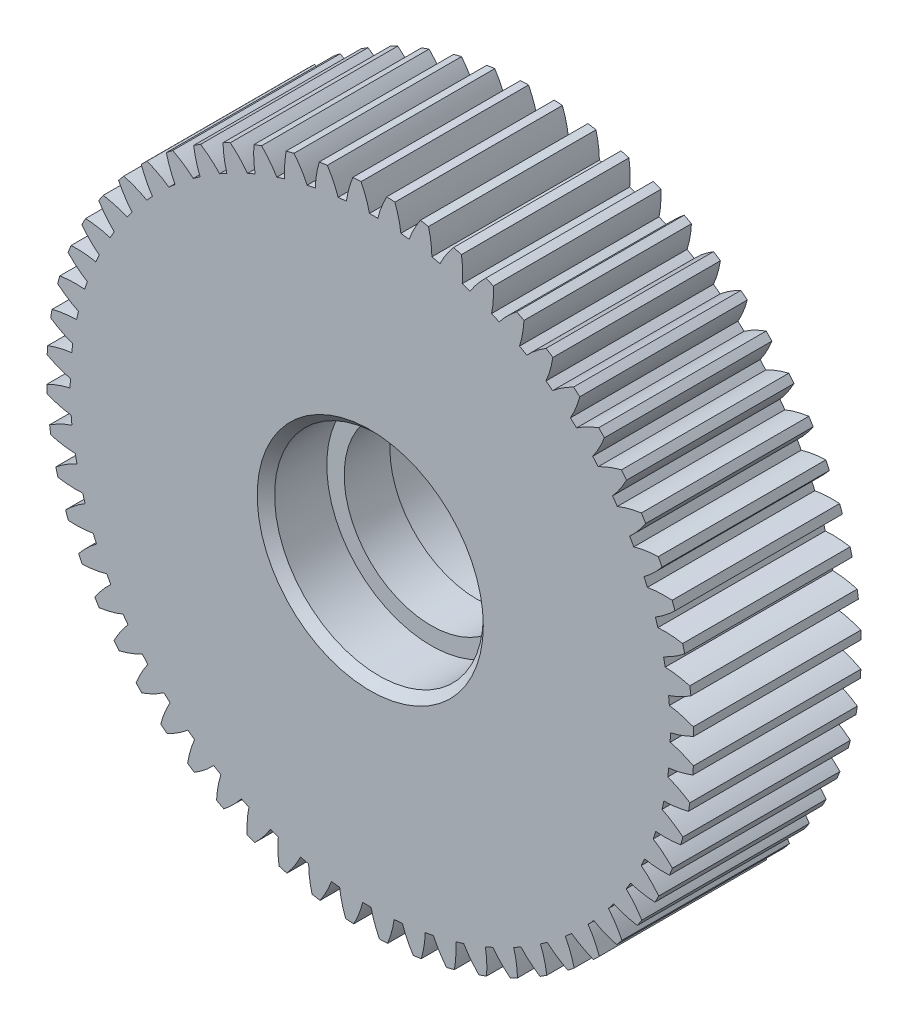
from build123d import *

# Parameters (mm, degrees)
SKETCH1_R               = 18.6
BOSS_EXTRUDE1_DEPTH     = 4.81475149
CUT_EXTRUDE1_DEPTH      = 27.741387995
CIRPATTERN2_COUNT       = 60
CUT_EXTRUDE2_DEPTH      = 29.001587569
CUT_EXTRUDE2_DEPTH_BACK = 29.001587569
SKETCH3_R               = 5
SKETCH4_R               = 6
CUT_EXTRUDE3_DEPTH      = 3.5
CHAMFER1_SIZE           = 0.5


with BuildPart() as part:
    # Sketch1 → Boss-Extrude1 (new, symmetric)
    with BuildSketch(Plane.XY):
        Circle(SKETCH1_R)
    extrude(amount=BOSS_EXTRUDE1_DEPTH, both=True)

    # Sketch2 → Cut-Extrude1 (cut, symmetric)
    with BuildSketch(Plane.XY):
        with BuildLine():
            ThreePointArc((17.249941202, 0.045039321), (17.2499853, 0.022519679), (17.25, 0))
            ThreePointArc((17.25, 0), (17.248903445, -0.194499201), (17.24561392, -0.388973675))
            ThreePointArc((17.24561392, -0.388973675), (17.245091423, -0.411487297), (17.244539536, -0.434000217))
            add(Edge.make_bspline(
                [(17.244539536, -0.434000217), (17.258527817, -0.437168535), (17.301163555, -0.44707828), (17.37218596, -0.464820787), (17.471136217, -0.492172992), (17.583720317, -0.526522356), (17.695488424, -0.563644772), (17.806310075, -0.603194988), (17.939890448, -0.654126402), (18.099116702, -0.719393509), (18.278642536, -0.799487731), (18.428403846, -0.87186963), (18.528503739, -0.922855573), (18.575850084, -0.947519737)],
                knots=[0.078773782, 0.078773782, 0.078773782, 0.078773782, 0.078773782, 0.092110525, 0.119476176, 0.146842496, 0.174208854, 0.201574956, 0.228941013, 0.256307345, 0.307035032, 0.361767352, 0.411345658, 0.411345658, 0.411345658, 0.411345658, 0.411345658], degree=4))
            ThreePointArc((18.575850084, -0.947519737), (18.593961541, -0.473913724), (18.6, 0))
            ThreePointArc((18.6, 0), (18.59812308, 0.264230806), (18.592492697, 0.528408284))
            add(Edge.make_bspline(
                [(17.249941202, 0.045039321), (17.263997369, 0.047891408), (17.306845723, 0.056837232), (17.378250149, 0.072973729), (17.477792016, 0.09808773), (17.59112204, 0.129889679), (17.703698809, 0.164482375), (17.815384108, 0.201523596), (17.950078978, 0.249429929), (18.110736468, 0.311090016), (18.292022715, 0.38711571), (18.4433781, 0.456102207), (18.544602233, 0.504818013), (18.592492697, 0.528408284)],
                knots=[0.078773782, 0.078773782, 0.078773782, 0.078773782, 0.078773782, 0.092110525, 0.119476176, 0.146842496, 0.174208854, 0.201574956, 0.228941013, 0.256307345, 0.307035032, 0.361767352, 0.411345658, 0.411345658, 0.411345658, 0.411345658, 0.411345658], degree=4))
        make_face()
    cut_extrude1 = extrude(amount=CUT_EXTRUDE1_DEPTH, both=True, mode=Mode.SUBTRACT)

    # CirPattern2: Cut-Extrude1 ×60 about axis
    cirpattern2_axis = Axis((0, 0, -4.81475149), (0, 0, 1))
    for i in range(1, CIRPATTERN2_COUNT):
        add(cut_extrude1.rotate(cirpattern2_axis, i * 360 / CIRPATTERN2_COUNT), mode=Mode.SUBTRACT)

    # Sketch3 → Cut-Extrude2 (cut, two sides: drawn at the far end of the back side and taken through both)
    with BuildSketch(Plane.XY.offset(4.81475149).offset(-CUT_EXTRUDE2_DEPTH_BACK)):
        Circle(SKETCH3_R)
    extrude(amount=CUT_EXTRUDE2_DEPTH + CUT_EXTRUDE2_DEPTH_BACK, mode=Mode.SUBTRACT)

    # Sketch4 → Cut-Extrude3 (cut)
    with BuildSketch(Plane.XY.offset(4.81475149)):
        Circle(SKETCH4_R)
    cut_extrude3 = extrude(amount=-CUT_EXTRUDE3_DEPTH, mode=Mode.SUBTRACT)

    # Mirror2: Cut-Extrude3 across plane
    add(cut_extrude3.mirror(Plane.XY), mode=Mode.SUBTRACT)

    # Chamfer1
    chamfer1_edges = [part.edges().sort_by_distance(p)[0] for p in [
        (-6, 0, 4.81475149),
        (-6, 0, -4.81475149),
    ]]
    chamfer(chamfer1_edges, length=CHAMFER1_SIZE)


solid = part.part
